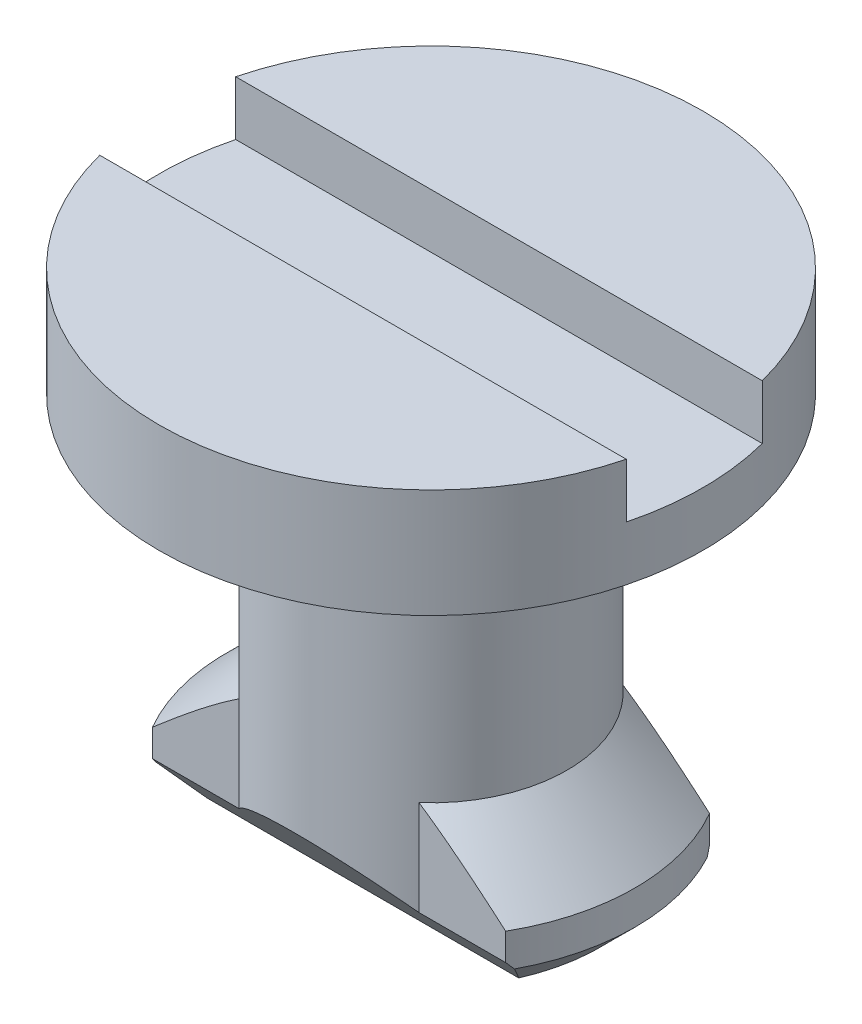
from build123d import *

# Parameters (mm, degrees)
SKETCH_1_R                      = 4
EXTRUDE_1_DEPTH                 = 1
SKETCH_3_R                      = 2
EXTRUDE_3_DEPTH                 = 6.4
EXTRUDE_4_DEPTH                 = 2
CHAMFER_1_SIZE                  = 0.5
CHAMFER_2_SIZE                  = 1
CUT_EXTRUDE_1_REACH             = 10.542
CUT_EXTRUDE_1_DIRECTION_2_REACH = 10.542
EXTRUDE_START                   = 0.6
SKETCH_6_R                      = 4
EXTRUDE_5_DEPTH                 = 0.6
SKETCH_7_W                      = 8
SKETCH_7_H                      = 2
CUT_EXTRUDE_2_DEPTH             = 0.8


with BuildPart() as part:
    # 草图1 → 凸台-拉伸1 (new body)
    with BuildSketch(Plane(origin=(0, 0, 0), x_dir=(1, 0, 0), z_dir=(0, 1, 0))):
        with Locations(Location((0, 0, 0), (0, 0, 270))):
            Circle(SKETCH_1_R)
    extrude(amount=EXTRUDE_1_DEPTH)

    # 草图3 → 凸台-拉伸3 (add)
    with BuildSketch(Plane(origin=(0, 0, 0), x_dir=(-1, 0, 0), z_dir=(0, -1, 0))):
        with Locations(Location((0, 0, 0), (0, 0, 270))):
            Circle(SKETCH_3_R)
    extrude(amount=EXTRUDE_3_DEPTH)

    # 草图4 → 凸台-拉伸4 (add)
    with BuildSketch(Plane(origin=(0, -6.4, 0), x_dir=(-1, 0, 0), z_dir=(0, -1, 0))):
        with BuildLine():
            Line((2.598076211, -1.5), (-2.598076211, -1.5))
            ThreePointArc((-2.598076211, -1.5), (-3, 0), (-2.598076211, 1.5))
            Line((-2.598076211, 1.5), (2.598076211, 1.5))
            ThreePointArc((2.598076211, 1.5), (3, 0), (2.598076211, -1.5))
        make_face()
    extrude(amount=-EXTRUDE_4_DEPTH)

    # 倒角1
    chamfer_1_edges = [part.edges().sort_by_distance(p)[0] for p in [
        (3, -6.4, 0),
        (-3, -6.4, 0),
    ]]
    chamfer(chamfer_1_edges, length=CHAMFER_1_SIZE)

    # 倒角2
    chamfer_2_edges = [part.edges().sort_by_distance(p)[0] for p in [
        (3, -4.4, 0),
        (-3, -4.4, 0),
    ]]
    chamfer(chamfer_2_edges, length=CHAMFER_2_SIZE - 0.0001)  # a hair under: the kernel refuses the full size

    # 草图5 → 切除-拉伸1 (cut, up to next)
    with BuildSketch(Plane(origin=(0, 0, 0), x_dir=(0, 0, -1), z_dir=(1, 0, 0)), mode=Mode.PRIVATE) as cut_extrude_1_sk1:
        Polygon((2, -5.2), (1, -6.4), (2, -6.4), align=None)
    cut_extrude_1_tool1 = extrude(cut_extrude_1_sk1.sketch, amount=-CUT_EXTRUDE_1_REACH, mode=Mode.PRIVATE) & part.part
    # 草图5 → 切除-拉伸1 (cut, up to next)
    with BuildSketch(Plane(origin=(0, 0, 0), x_dir=(0, 0, -1), z_dir=(1, 0, 0)), mode=Mode.PRIVATE) as cut_extrude_1_sk2:
        Polygon((-2, -5.2), (-2, -6.4), (-1, -6.4), align=None)
    cut_extrude_1_tool2 = extrude(cut_extrude_1_sk2.sketch, amount=-CUT_EXTRUDE_1_REACH, mode=Mode.PRIVATE) & part.part
    add(cut_extrude_1_tool1.solids().sort_by_distance((0, -6, -1.666667))[0], mode=Mode.SUBTRACT)
    add(cut_extrude_1_tool2.solids().sort_by_distance((0, -6, 1.666667))[0], mode=Mode.SUBTRACT)

    # 草图5 → 切除-拉伸1 direction 2 (cut, up to next)
    with BuildSketch(Plane(origin=(0, 0, 0), x_dir=(0, 0, -1), z_dir=(1, 0, 0)), mode=Mode.PRIVATE) as cut_extrude_1_direction_2_sk1:
        Polygon((2, -5.2), (1, -6.4), (2, -6.4), align=None)
    cut_extrude_1_direction_2_tool1 = extrude(cut_extrude_1_direction_2_sk1.sketch, amount=CUT_EXTRUDE_1_DIRECTION_2_REACH, mode=Mode.PRIVATE) & part.part
    # 草图5 → 切除-拉伸1 direction 2 (cut, up to next)
    with BuildSketch(Plane(origin=(0, 0, 0), x_dir=(0, 0, -1), z_dir=(1, 0, 0)), mode=Mode.PRIVATE) as cut_extrude_1_direction_2_sk2:
        Polygon((-2, -5.2), (-2, -6.4), (-1, -6.4), align=None)
    cut_extrude_1_direction_2_tool2 = extrude(cut_extrude_1_direction_2_sk2.sketch, amount=CUT_EXTRUDE_1_DIRECTION_2_REACH, mode=Mode.PRIVATE) & part.part
    add(cut_extrude_1_direction_2_tool1.solids().sort_by_distance((0, -6, -1.666667))[0], mode=Mode.SUBTRACT)
    add(cut_extrude_1_direction_2_tool2.solids().sort_by_distance((0, -6, 1.666667))[0], mode=Mode.SUBTRACT)

    # 草图6 → 凸台-拉伸5 (add)
    with BuildSketch(Plane.XZ.offset(EXTRUDE_START)):
        with Locations(Location((0, 0, 0), (0, 0, 270))):
            Circle(SKETCH_6_R)
    extrude(amount=-EXTRUDE_5_DEPTH)

    # 草图7 → 切除-拉伸2 (cut)
    with BuildSketch(Plane(origin=(0, 1, 0), x_dir=(1, 0, 0), z_dir=(0, 1, 0))):
        Rectangle(SKETCH_7_W, SKETCH_7_H)
    extrude(amount=-CUT_EXTRUDE_2_DEPTH, mode=Mode.SUBTRACT)


solid = part.part
